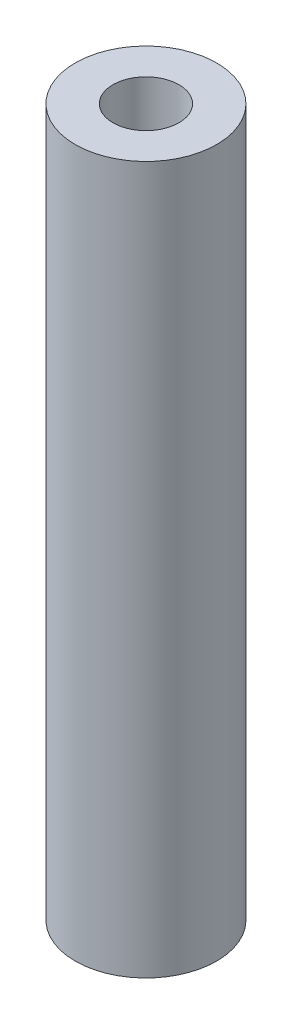
from build123d import *

# Parameters (mm, degrees)
SKETCH1_R       = 3
SKETCH1_R_2     = 1.4
EXTRUSION_DEPTH = 30


with BuildPart() as part:
    # Sketch1 → Extrusion (new body)
    with BuildSketch(Plane(origin=(0, 0, 0), x_dir=(1, 0, 0), z_dir=(0, 1, 0))):
        Circle(SKETCH1_R)
        Circle(SKETCH1_R_2, mode=Mode.SUBTRACT)
    extrude(amount=EXTRUSION_DEPTH)


solid = part.part
